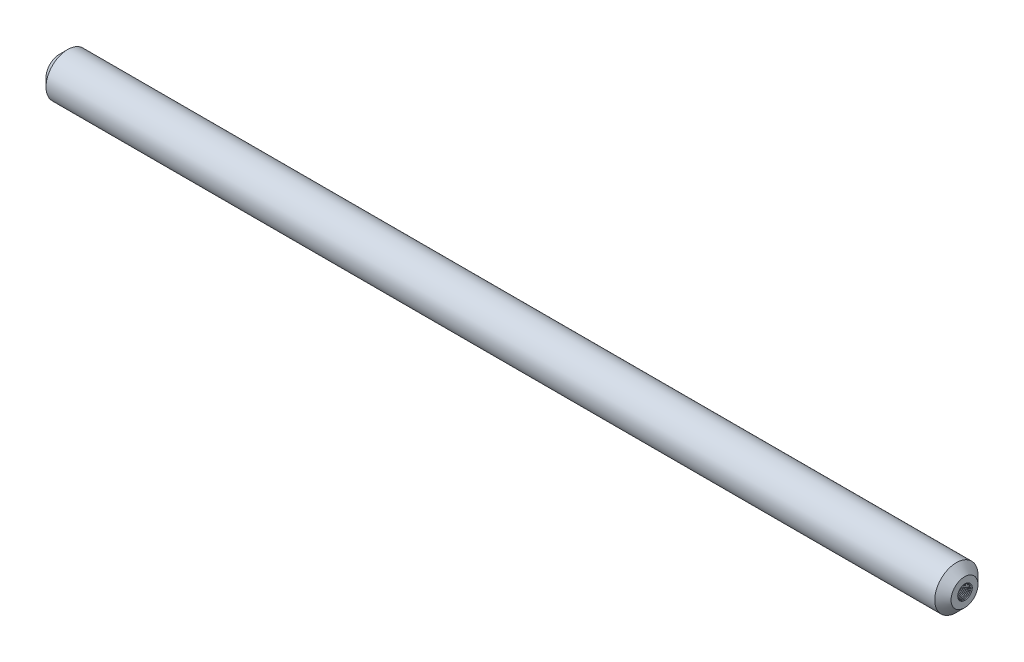
from build123d import *

# Parameters (mm, degrees)
SKETCH1_R           = 7.9375
BOSS_EXTRUDE1_DEPTH = 332
SKETCH2_R           = 2.5
CUT_EXTRUDE1_DEPTH  = 24
CUT_EXTRUDE2_START  = -24
SKETCH3_R           = 2.5
CUT_EXTRUDE2_DEPTH  = 24
CUT_SWEEP5_PITCH    = 0.5
CUT_SWEEP6_PITCH    = 0.5
CHAMFER1_SIZE       = 3


with BuildPart() as part:
    # Sketch1 → Boss-Extrude1 (new body)
    with BuildSketch(Plane(origin=(0, 0, 0), x_dir=(0, 0, -1), z_dir=(1, 0, 0))):
        Circle(SKETCH1_R)
    extrude(amount=-BOSS_EXTRUDE1_DEPTH)

    # Sketch2 → Cut-Extrude1 (cut)
    with BuildSketch(Plane(origin=(0, 0, 0), x_dir=(0, 0, -1), z_dir=(1, 0, 0))):
        Circle(SKETCH2_R)
    extrude(amount=-CUT_EXTRUDE1_DEPTH, mode=Mode.SUBTRACT)

    # Sketch3 → Cut-Extrude2 (cut)
    with BuildSketch(Plane.ZY.offset(332).offset(CUT_EXTRUDE2_START)):
        with Locations(Location((0, 0, 0), (0, 0, 180))):
            Circle(SKETCH3_R)
    extrude(amount=CUT_EXTRUDE2_DEPTH, mode=Mode.SUBTRACT)

    # Cut-Sweep5: arcs per turn and ends read off the stored shape
    # Cut-Sweep5: the profile of 3DSketch6 profile screwed along a right-hand helix through 37 turns, 6 arcs to a turn; built about Z, then put on its axis
    cut_sweep5_z = Axis((0, 0, 0), (0, 0, 1))
    cut_sweep5_corners = [(2.4997, 0, -0.700174018), (2.4997, 0, -0.299828416), (2.847219747, 0, -0.498591157)]
    with BuildLine(mode=Mode.PRIVATE) as cut_sweep5_profile:
        Line(cut_sweep5_corners[0], cut_sweep5_corners[1])
        Line(cut_sweep5_corners[1], cut_sweep5_corners[2])
        Line(cut_sweep5_corners[2], cut_sweep5_corners[0])
    cut_sweep5_cap = Face(cut_sweep5_profile.wire())
    cut_sweep5_turn_angles = [0, 30, 60, 90, 120, 150, 180, 210, 240, 270, 300, 330, 360]
    cut_sweep5_turn_weights = [1, 0.8660254037844387, 1, 0.8660254037844387, 1, 0.8660254037844387, 1, 0.8660254037844387, 1, 0.8660254037844387, 1, 0.8660254037844387, 1]
    cut_sweep5_turn_rails = [Edge.make_bspline([Vector(p[0], p[1], 0).rotate(cut_sweep5_z, cut_sweep5_turn_angles[k]) / cut_sweep5_turn_weights[k] + Vector(0, 0, p[2] + CUT_SWEEP5_PITCH * cut_sweep5_turn_angles[k] / 360) for k in range(13)], [0, 0, 0, 1, 1, 2, 2, 3, 3, 4, 4, 5, 5, 6, 6, 6], 2, cut_sweep5_turn_weights) for p in cut_sweep5_corners]
    cut_sweep5_turn_sides = [Face.make_surface_from_curves(cut_sweep5_turn_rails[p[0]], cut_sweep5_turn_rails[p[1]]) for p in [(0, 1), (1, 2), (2, 0)]]
    cut_sweep5 = Plane(origin=(0, 0, 0), x_dir=(0, 0, -1), z_dir=(-1, 0, 0)) * Solid(Shell([*[p.moved(Location((0, 0, CUT_SWEEP5_PITCH * i))) for i in range(37) for p in cut_sweep5_turn_sides], cut_sweep5_cap, cut_sweep5_cap.rotate(cut_sweep5_z, 13320).moved(Location((0, 0, CUT_SWEEP5_PITCH * 13320 / 360)))]))
    add(cut_sweep5, mode=Mode.SUBTRACT)

    # Cut-Sweep6: arcs per turn and ends read off the stored shape
    # Cut-Sweep6: the profile of 3DSketch8 profile screwed along a right-hand helix through 37 turns, 6 arcs to a turn; built about Z, then put on its axis
    cut_sweep6_z = Axis((0, 0, 0), (0, 0, 1))
    cut_sweep6_corners = [(2.4997, 0, -0.299826795), (2.846410162, 0, -0.5), (2.4997, 0, -0.700173205)]
    with BuildLine(mode=Mode.PRIVATE) as cut_sweep6_profile:
        Line(cut_sweep6_corners[0], cut_sweep6_corners[1])
        Line(cut_sweep6_corners[1], cut_sweep6_corners[2])
        Line(cut_sweep6_corners[2], cut_sweep6_corners[0])
    cut_sweep6_cap = Face(cut_sweep6_profile.wire())
    cut_sweep6_turn_angles = [0, 30, 60, 90, 120, 150, 180, 210, 240, 270, 300, 330, 360]
    cut_sweep6_turn_weights = [1, 0.8660254037844387, 1, 0.8660254037844387, 1, 0.8660254037844387, 1, 0.8660254037844387, 1, 0.8660254037844387, 1, 0.8660254037844387, 1]
    cut_sweep6_turn_rails = [Edge.make_bspline([Vector(p[0], p[1], 0).rotate(cut_sweep6_z, cut_sweep6_turn_angles[k]) / cut_sweep6_turn_weights[k] + Vector(0, 0, p[2] + CUT_SWEEP6_PITCH * cut_sweep6_turn_angles[k] / 360) for k in range(13)], [0, 0, 0, 1, 1, 2, 2, 3, 3, 4, 4, 5, 5, 6, 6, 6], 2, cut_sweep6_turn_weights) for p in cut_sweep6_corners]
    cut_sweep6_turn_sides = [Face.make_surface_from_curves(cut_sweep6_turn_rails[p[0]], cut_sweep6_turn_rails[p[1]]) for p in [(0, 1), (1, 2), (2, 0)]]
    cut_sweep6 = Plane(origin=(-332, 0, 0), x_dir=(0, 0, 1), z_dir=(1, 0, 0)) * Solid(Shell([*[p.moved(Location((0, 0, CUT_SWEEP6_PITCH * i))) for i in range(37) for p in cut_sweep6_turn_sides], cut_sweep6_cap, cut_sweep6_cap.rotate(cut_sweep6_z, 13320).moved(Location((0, 0, CUT_SWEEP6_PITCH * 13320 / 360)))]))
    add(cut_sweep6, mode=Mode.SUBTRACT)

    # Chamfer1
    chamfer1_edges = [part.edges().sort_by_distance(p)[0] for p in [
        (0, 0, 7.9375),
        (-332, 0, 7.9375),
    ]]
    chamfer(chamfer1_edges, length=CHAMFER1_SIZE)


solid = part.part
